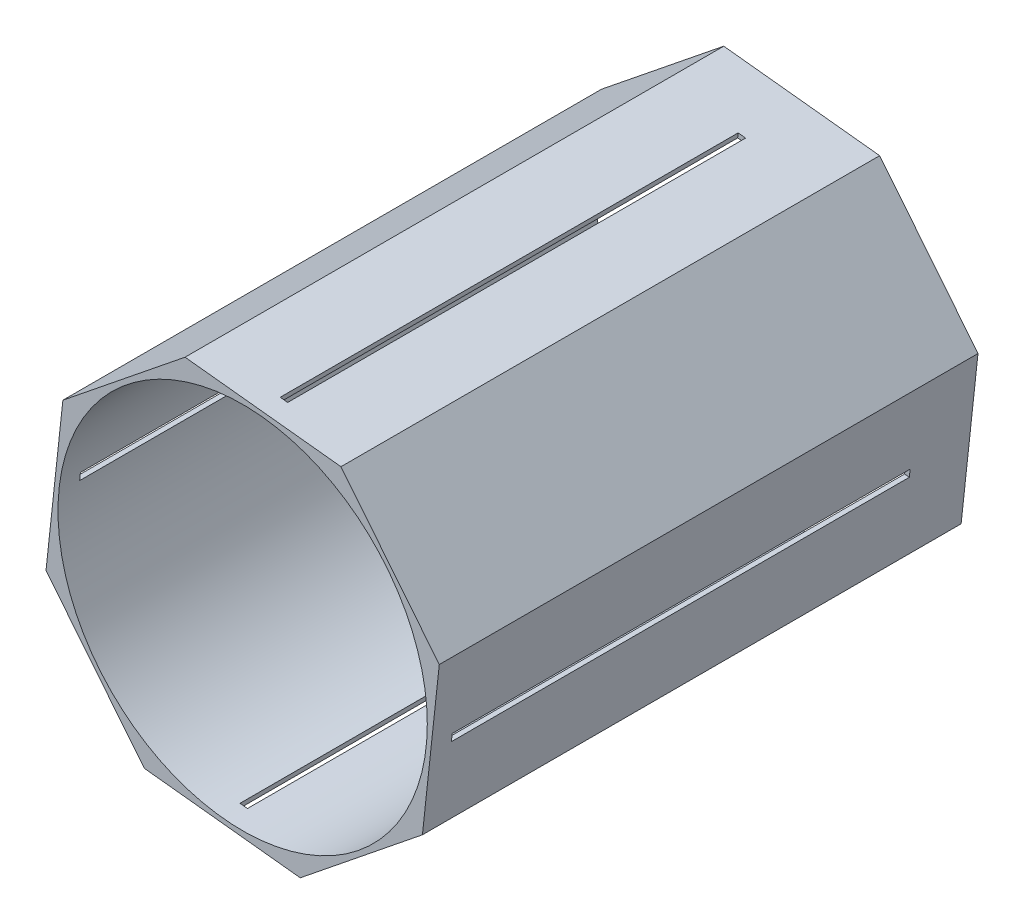
from build123d import *

# Parameters (mm, degrees)
SKETCH1_R           = 78.359
BOSS_EXTRUDE1_DEPTH = 228.6
SKETCH2_W           = 3.175
SKETCH2_H           = 194.31
CUT_EXTRUDE1_DEPTH  = 203.2
SKETCH5_W           = 194.31
SKETCH5_H           = 3.175
CUT_EXTRUDE2_DEPTH  = 203.2


with BuildPart() as part:
    # Sketch1 → Boss-Extrude1 (new body)
    with BuildSketch(Plane.XY):
        Polygon((76.286003624, -41.721564111), (83.443951376, 24.440749568), (41.721564111, 76.286003624), (-24.440749568, 83.443951376), (-76.286003624, 41.721564111), (-83.443951376, -24.440749568), (-41.721564111, -76.286003624), (24.440749568, -83.443951376), align=None)
        Circle(SKETCH1_R, mode=Mode.SUBTRACT)
    extrude(amount=BOSS_EXTRUDE1_DEPTH)

    # Sketch2 → Cut-Extrude1 (cut)
    with BuildSketch(Plane(origin=(8.640407271, 79.8649775, 0), x_dir=(0.9941985899756116, -0.10756004690639372, 0), z_dir=(0.10756004690639372, 0.9941985899756116, 0))):
        with Locations((0, -122.555)):
            Rectangle(SKETCH2_W, SKETCH2_H)
    extrude(amount=-CUT_EXTRUDE1_DEPTH, mode=Mode.SUBTRACT)

    # Sketch5 → Cut-Extrude2 (cut)
    with BuildSketch(Plane(origin=(-79.8649775, 8.640407271, 0), x_dir=(0, 0, 1), z_dir=(-0.9941985899756116, 0.10756004690639381, 0))):
        with Locations((122.555, 0)):
            Rectangle(SKETCH5_W, SKETCH5_H)
    extrude(amount=-CUT_EXTRUDE2_DEPTH, mode=Mode.SUBTRACT)


solid = part.part
